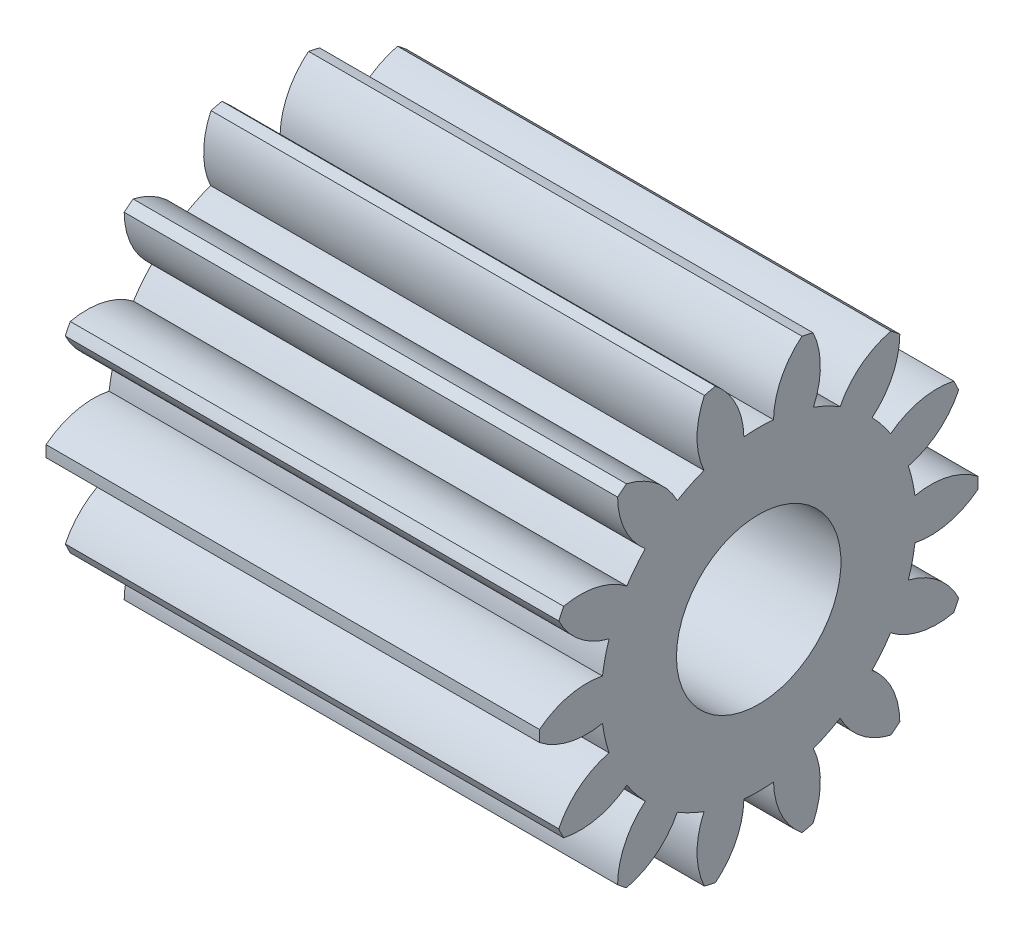
from build123d import *

# Parameters (mm, degrees)
BASPROSKE_W     = 9
BASPROSKE_H     = 4
TOOTHCUT_DEPTH  = 11.630145813
TEETHCUTS_COUNT = 14
TEETHCUTS_ANGLE = 334.285714286
BORSKE_R        = 1.5
BORE_DEPTH      = 50.0000508


with BuildPart() as part:
    # BasProSke → Base-Revolve (revolve)
    with BuildSketch(Plane(origin=(0, 0, 0), x_dir=(1, 0, 0), z_dir=(0, 1, 0))):
        with Locations((4.5, 2)):
            Rectangle(BASPROSKE_W, BASPROSKE_H)
    revolve(axis=Axis((-10, 0, 0), (1, 0, 0)))

    # TooCutSke → ToothCut (cut, through all)
    with BuildSketch(Plane(origin=(0, 0, 0), x_dir=(0, 0, -1), z_dir=(1, 0, 0))):
        with BuildLine():
            ThreePointArc((0.270186573, 2.861271608), (0, 2.874), (-0.270186573, 2.861271608))
            ThreePointArc((-0.270186573, 2.861271608), (-0.419730174, 3.4635664), (-0.814922833, 3.942048444))
            ThreePointArc((-0.814922833, 3.942048444), (0, 4.0254), (0.814922833, 3.942048444))
            ThreePointArc((0.814922833, 3.942048444), (0.419730174, 3.4635664), (0.270186573, 2.861271608))
        make_face()
    toothcut = extrude(amount=TOOTHCUT_DEPTH, mode=Mode.SUBTRACT)

    # TeethCuts: ToothCut ×14 about axis
    teethcuts_axis = Axis((-10, 0, 0), (1, 0, 0))
    for i in range(1, TEETHCUTS_COUNT):
        add(toothcut.rotate(teethcuts_axis, i * TEETHCUTS_ANGLE / (TEETHCUTS_COUNT - 1)), mode=Mode.SUBTRACT)

    # BorSke → Bore (cut, symmetric)
    with BuildSketch(Plane(origin=(0, 0, 0), x_dir=(0, 0, -1), z_dir=(1, 0, 0))):
        Circle(BORSKE_R)
    extrude(amount=BORE_DEPTH, both=True, mode=Mode.SUBTRACT)


solid = part.part
